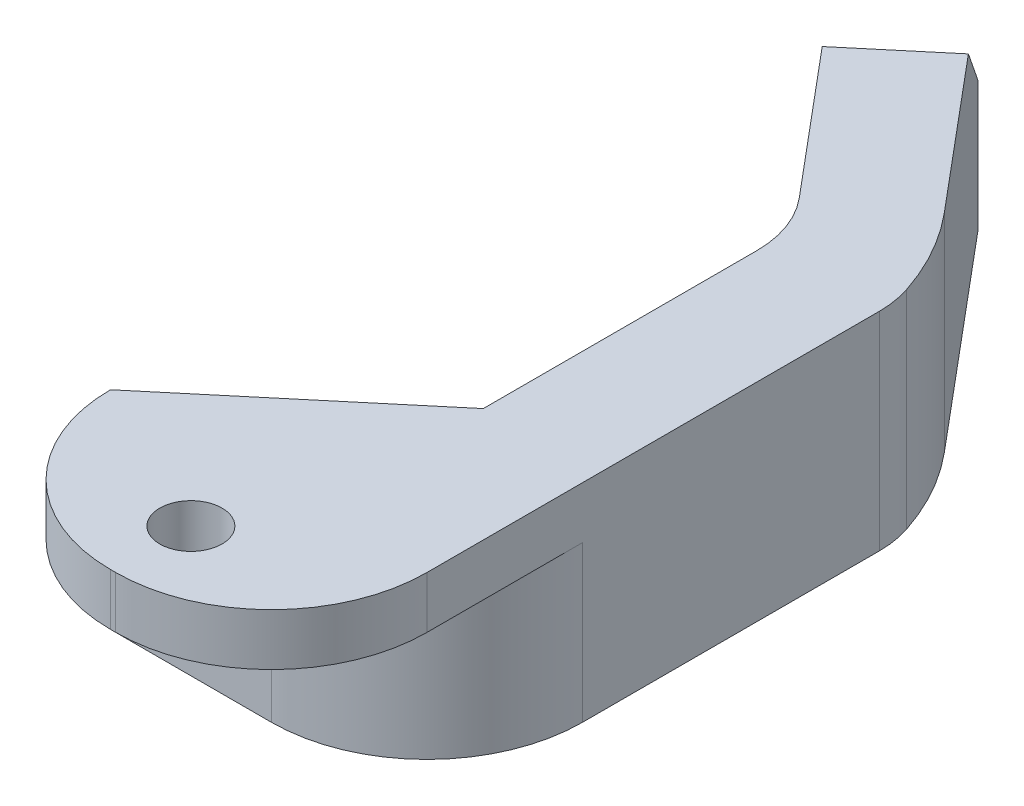
from build123d import *

# Parameters (mm, degrees)
BOSS_EXTRUDE1_DEPTH = 20
SKETCH5_W           = 15
SKETCH5_H           = 15
CUT_EXTRUDE1_DEPTH  = 40
SKETCH6_R           = 3
CUT_EXTRUDE2_DEPTH  = 34
FILLET1_R           = 15
FILLET2_R           = 15
FILLET3_R           = 25
FILLET4_R           = 10
CUT_EXTRUDE3_DEPTH  = 34
FILLET5_R           = 10


# Some blends are built 0.0001 mm under size
with BuildPart() as part:
    # Sketch3 → Boss-Extrude1 (new body)
    with BuildSketch(Plane(origin=(0, 0, 0), x_dir=(1, 0, 0), z_dir=(0, 1, 0))):
        Polygon((0, 0), (30.5, 0), (30.5, 60), (29.894285691, 64.601573483), (8.489458289, 90.110853439), (0.829013858, 83.682977342), (19.5341333, 61.391084047), (19.5341333, 31.391084047), (0, 15), align=None)
    extrude(amount=BOSS_EXTRUDE1_DEPTH)

    # Sketch5 → Cut-Extrude1 (cut)
    with BuildSketch(Plane(origin=(30.5, 0, 0), x_dir=(0, 0, -1), z_dir=(1, 0, 0))):
        with Locations((7.5, 7.5)):
            Rectangle(SKETCH5_W, SKETCH5_H)
    extrude(amount=-CUT_EXTRUDE1_DEPTH, mode=Mode.SUBTRACT)

    # Sketch6 → Cut-Extrude2 (cut)
    with BuildSketch(Plane(origin=(0, 20, 0), x_dir=(1, 0, 0), z_dir=(0, 1, 0))):
        with Locations(Location((15.25, 7.5, 0), (0, 0, 270))):
            Circle(SKETCH6_R)
    extrude(amount=-CUT_EXTRUDE2_DEPTH, mode=Mode.SUBTRACT)

    # Fillet1
    fillet1_edges = [part.edges().sort_by_distance(p)[0] for p in [
        (0, 17.5, 0),
        (30.5, 17.5, 0),
    ]]
    fillet(fillet1_edges, radius=FILLET1_R - 0.0001)  # a hair under: the kernel refuses the full size

    # Fillet2
    fillet2_edges = [part.edges().sort_by_distance(p)[0] for p in [
        (30.5, 7.5, -15),
    ]]
    fillet(fillet2_edges, radius=FILLET2_R)

    # Fillet3
    # the kernel refuses this fillet: 25 mm, written as the material it takes off along each edge
    with BuildSketch(Plane(origin=(29.894285691, -17.425359882, -64.601573483), x_dir=(-0.64278760968654, 0, -0.7660444431189775), z_dir=(0, 1, 0))) as fillet3_piece_1:
        with BuildLine():
            CenterArc((6.970143953, 25), FILLET3_R, 244.190525193, 25.809474807)
            Line((-3.914355449, 2.49383034), (-4.132045437, 2.043706946))
            ThreePointArc((-4.132045437, 2.043706946), (-2.225836026, 0.825224861), (-0.268658302, -0.421690309))
            Line((-0.268658302, -0.421690309), (0, -0.5))
            Line((0, -0.5), (6.970143953, -0.5))
            Line((6.970143953, -0.5), (6.970143953, 0))
        make_face()
    extrude(amount=54.850719763, mode=Mode.SUBTRACT)

    # Fillet4
    fillet4_edges = [part.edges().sort_by_distance(p)[0] for p in [
        (19.5341333, 10, -61.391084047),
    ]]
    fillet(fillet4_edges, radius=FILLET4_R)

    # Sketch7 → Cut-Extrude3 (cut)
    with BuildSketch(Plane(origin=(49.352752173, 0, -41.411876146), x_dir=(-0.6427876096865405, 0, -0.7660444431189772), z_dir=(0.7660444431189772, 0, -0.6427876096865404))):
        Polygon((56.07199994, 20), (63.57199994, 20), (63.57199994, 12.5), align=None)
    extrude(amount=-CUT_EXTRUDE3_DEPTH, mode=Mode.SUBTRACT)

    # Fillet5
    fillet5_edges = [part.edges().sort_by_distance(p)[0] for p in [
        (30.5, 10, -60),
    ]]
    fillet(fillet5_edges, radius=FILLET5_R)


solid = part.part
